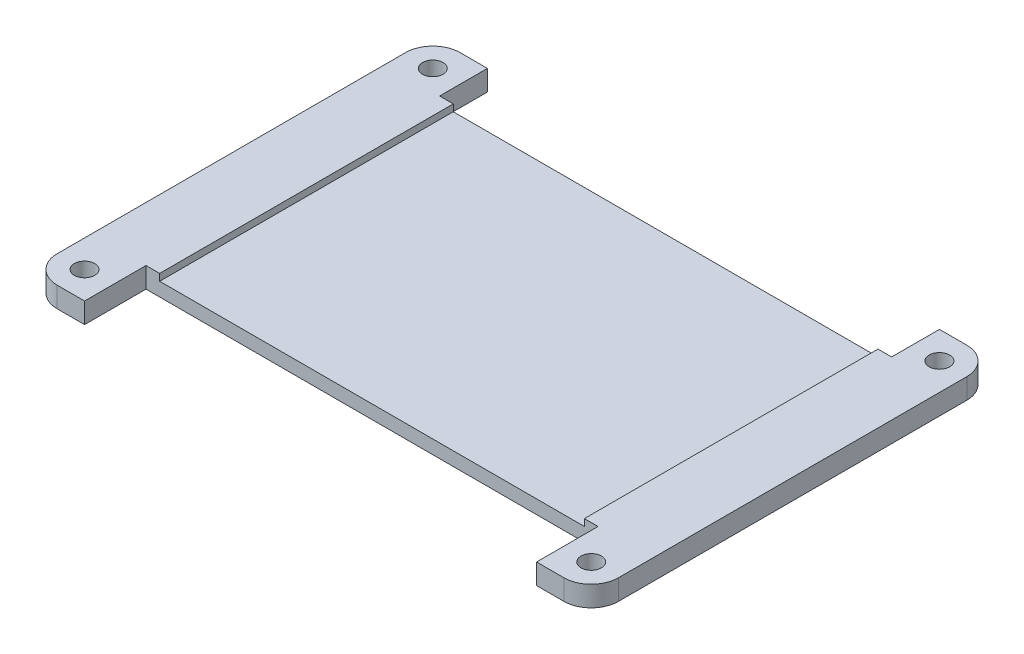
from build123d import *

# Parameters (mm, degrees)
SKETCH1_R           = 1.5
BOSS_EXTRUDE1_DEPTH = 3
SKETCH2_W           = 62.2
SKETCH2_H           = 43
CUT_EXTRUDE1_DEPTH  = 1
FILLET1_R           = 4


with BuildPart() as part:
    # Sketch1 → Boss-Extrude1 (new body)
    with BuildSketch(Plane(origin=(0, 0, 0), x_dir=(1, 0, 0), z_dir=(0, 1, 0))):
        Polygon((8, 52), (8, 59), (0, 59), (0, 0), (8, 0), (8, 9), (74.2, 9), (74.2, 0), (82.2, 0), (82.2, 59), (74.2, 59), (74.2, 52), align=None)
        with Locations((4, 4)):
            Circle(SKETCH1_R, mode=Mode.SUBTRACT)
        with Locations((78.2, 4)):
            Circle(SKETCH1_R, mode=Mode.SUBTRACT)
        with Locations((4, 55)):
            Circle(SKETCH1_R, mode=Mode.SUBTRACT)
        with Locations((78.2, 55)):
            Circle(SKETCH1_R, mode=Mode.SUBTRACT)
    extrude(amount=BOSS_EXTRUDE1_DEPTH)

    # Sketch2 → Cut-Extrude1 (cut)
    with BuildSketch(Plane(origin=(0, 3, 0), x_dir=(1, 0, 0), z_dir=(0, 1, 0))):
        with Locations((41.1, 30.5)):
            Rectangle(SKETCH2_W, SKETCH2_H)
    extrude(amount=-CUT_EXTRUDE1_DEPTH, mode=Mode.SUBTRACT)

    # Fillet1
    fillet1_edges = [part.edges().sort_by_distance(p)[0] for p in [
        (82.2, 1.5, -59),
        (82.2, 1.5, 0),
        (0, 1.5, 0),
        (0, 1.5, -59),
    ]]
    fillet(fillet1_edges, radius=FILLET1_R)


solid = part.part
